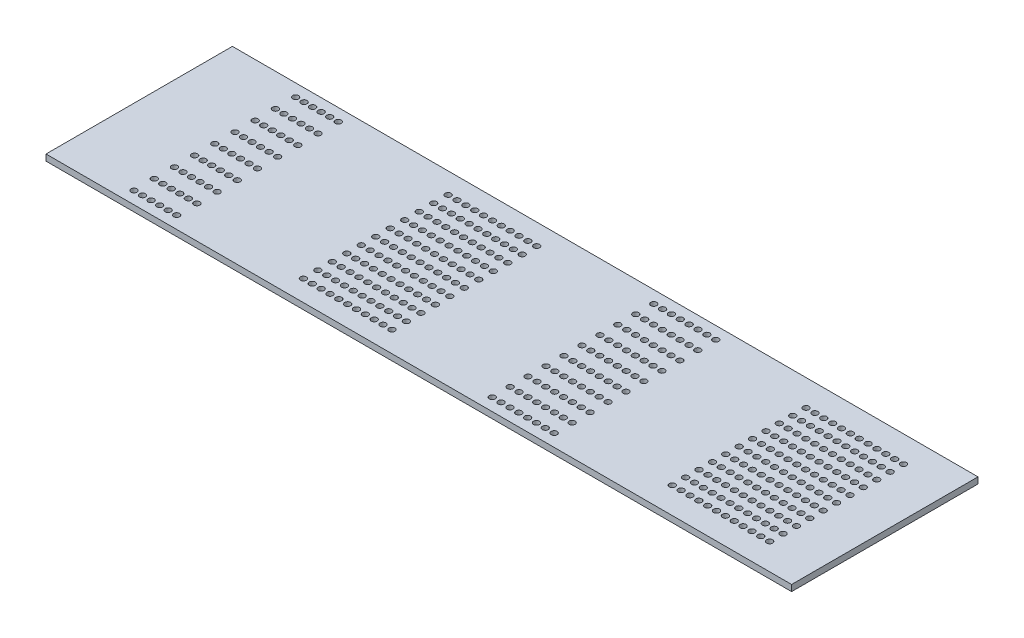
from build123d import *

# Parameters (mm, degrees)
ESQUISSE2_W                     = 120
ESQUISSE2_H                     = 30
BOSS_EXTRU_1_DEPTH              = 1
ENL_V_MAT_EXTRU_3_REACH         = 63.855
ESQUISSE8_R                     = 0.475
R_P_TITION_LIN_AIRE4_COUNT      = 6
R_P_TITION_LIN_AIRE4_PITCH      = 1.372
R_P_TITION_LIN_AIRE4_COUNT_DIR2 = 9
R_P_TITION_LIN_AIRE4_PITCH_DIR2 = 3.25
ENL_V_MAT_EXTRU_4_REACH         = 63.855
ESQUISSE10_R                    = 0.475
R_P_TITION_LIN_AIRE5_COUNT      = 11
R_P_TITION_LIN_AIRE5_PITCH      = 1.425
R_P_TITION_LIN_AIRE5_COUNT_DIR2 = 11
R_P_TITION_LIN_AIRE5_PITCH_DIR2 = 2.33
ENL_V_MAT_EXTRU_5_REACH         = 63.855
ESQUISSE12_R                    = 0.475
R_P_TITION_LIN_AIRE6_COUNT      = 8
R_P_TITION_LIN_AIRE6_PITCH      = 1.425
R_P_TITION_LIN_AIRE6_COUNT_DIR2 = 10
R_P_TITION_LIN_AIRE6_PITCH_DIR2 = 2.888888889
ENL_V_MAT_EXTRU_6_REACH         = 63.855
ESQUISSE14_R                    = 0.475
R_P_TITION_LIN_AIRE7_COUNT      = 12
R_P_TITION_LIN_AIRE7_PITCH      = 1.425
R_P_TITION_LIN_AIRE7_COUNT_DIR2 = 11
R_P_TITION_LIN_AIRE7_PITCH_DIR2 = 2.154


with BuildPart() as part:
    # Esquisse2 → Boss.-Extru.1 (new body)
    with BuildSketch(Plane(origin=(0, 0, 0), x_dir=(1, 0, 0), z_dir=(0, 1, 0))):
        Rectangle(ESQUISSE2_W, ESQUISSE2_H)
    extrude(amount=BOSS_EXTRU_1_DEPTH)

    # Esquisse8 → Enlèv. mat.-Extru.3 (cut, up to next)
    with BuildSketch(Plane(origin=(0, 1, 0), x_dir=(1, 0, 0), z_dir=(0, 1, 0)), mode=Mode.PRIVATE) as enl_v_mat_extru_3_sk1:
        with Locations((-47.83, 13)):
            Circle(ESQUISSE8_R)
    enl_v_mat_extru_3_tool1 = extrude(enl_v_mat_extru_3_sk1.sketch, amount=-ENL_V_MAT_EXTRU_3_REACH, mode=Mode.PRIVATE) & part.part
    enl_v_mat_extru_3 = enl_v_mat_extru_3_tool1.solids().sort_by_distance((-47.83, 1, -13))[0]
    add(enl_v_mat_extru_3, mode=Mode.SUBTRACT)

    # Répétition linéaire4: Enl_v. mat.-Extru.3 6 × 9
    with Locations(*[(i * R_P_TITION_LIN_AIRE4_PITCH, 0, j * R_P_TITION_LIN_AIRE4_PITCH_DIR2) for i in range(R_P_TITION_LIN_AIRE4_COUNT) for j in range(R_P_TITION_LIN_AIRE4_COUNT_DIR2) if (i, j) != (0, 0)]):
        add(enl_v_mat_extru_3, mode=Mode.SUBTRACT)

    # Esquisse10 → Enlèv. mat.-Extru.4 (cut, up to next)
    with BuildSketch(Plane(origin=(0, 1, 0), x_dir=(1, 0, 0), z_dir=(0, 1, 0)), mode=Mode.PRIVATE) as enl_v_mat_extru_4_sk1:
        with Locations((-21.925, 11.65)):
            Circle(ESQUISSE10_R)
    enl_v_mat_extru_4_tool1 = extrude(enl_v_mat_extru_4_sk1.sketch, amount=-ENL_V_MAT_EXTRU_4_REACH, mode=Mode.PRIVATE) & part.part
    enl_v_mat_extru_4 = enl_v_mat_extru_4_tool1.solids().sort_by_distance((-21.925, 1, -11.65))[0]
    add(enl_v_mat_extru_4, mode=Mode.SUBTRACT)

    # Répétition linéaire5: Enl_v. mat.-Extru.4 11 × 11
    with Locations(*[(i * R_P_TITION_LIN_AIRE5_PITCH, 0, j * R_P_TITION_LIN_AIRE5_PITCH_DIR2) for i in range(R_P_TITION_LIN_AIRE5_COUNT) for j in range(R_P_TITION_LIN_AIRE5_COUNT_DIR2) if (i, j) != (0, 0)]):
        add(enl_v_mat_extru_4, mode=Mode.SUBTRACT)

    # Esquisse12 → Enlèv. mat.-Extru.5 (cut, up to next)
    with BuildSketch(Plane(origin=(0, 1, 0), x_dir=(1, 0, 0), z_dir=(0, 1, 0)), mode=Mode.PRIVATE) as enl_v_mat_extru_5_sk1:
        with Locations((9.8125, 13)):
            Circle(ESQUISSE12_R)
    enl_v_mat_extru_5_tool1 = extrude(enl_v_mat_extru_5_sk1.sketch, amount=-ENL_V_MAT_EXTRU_5_REACH, mode=Mode.PRIVATE) & part.part
    enl_v_mat_extru_5 = enl_v_mat_extru_5_tool1.solids().sort_by_distance((9.8125, 1, -13))[0]
    add(enl_v_mat_extru_5, mode=Mode.SUBTRACT)

    # Répétition linéaire6: Enl_v. mat.-Extru.5 8 × 10
    with Locations(*[(i * R_P_TITION_LIN_AIRE6_PITCH, 0, j * R_P_TITION_LIN_AIRE6_PITCH_DIR2) for i in range(R_P_TITION_LIN_AIRE6_COUNT) for j in range(R_P_TITION_LIN_AIRE6_COUNT_DIR2) if (i, j) != (0, 0)]):
        add(enl_v_mat_extru_5, mode=Mode.SUBTRACT)

    # Esquisse14 → Enlèv. mat.-Extru.6 (cut, up to next)
    with BuildSketch(Plane(origin=(0, 1, 0), x_dir=(1, 0, 0), z_dir=(0, 1, 0)), mode=Mode.PRIVATE) as enl_v_mat_extru_6_sk1:
        with Locations((36.5625, 10.77)):
            Circle(ESQUISSE14_R)
    enl_v_mat_extru_6_tool1 = extrude(enl_v_mat_extru_6_sk1.sketch, amount=-ENL_V_MAT_EXTRU_6_REACH, mode=Mode.PRIVATE) & part.part
    enl_v_mat_extru_6 = enl_v_mat_extru_6_tool1.solids().sort_by_distance((36.5625, 1, -10.77))[0]
    add(enl_v_mat_extru_6, mode=Mode.SUBTRACT)

    # Répétition linéaire7: Enl_v. mat.-Extru.6 12 × 11
    with Locations(*[(i * R_P_TITION_LIN_AIRE7_PITCH, 0, j * R_P_TITION_LIN_AIRE7_PITCH_DIR2) for i in range(R_P_TITION_LIN_AIRE7_COUNT) for j in range(R_P_TITION_LIN_AIRE7_COUNT_DIR2) if (i, j) != (0, 0)]):
        add(enl_v_mat_extru_6, mode=Mode.SUBTRACT)


solid = part.part
